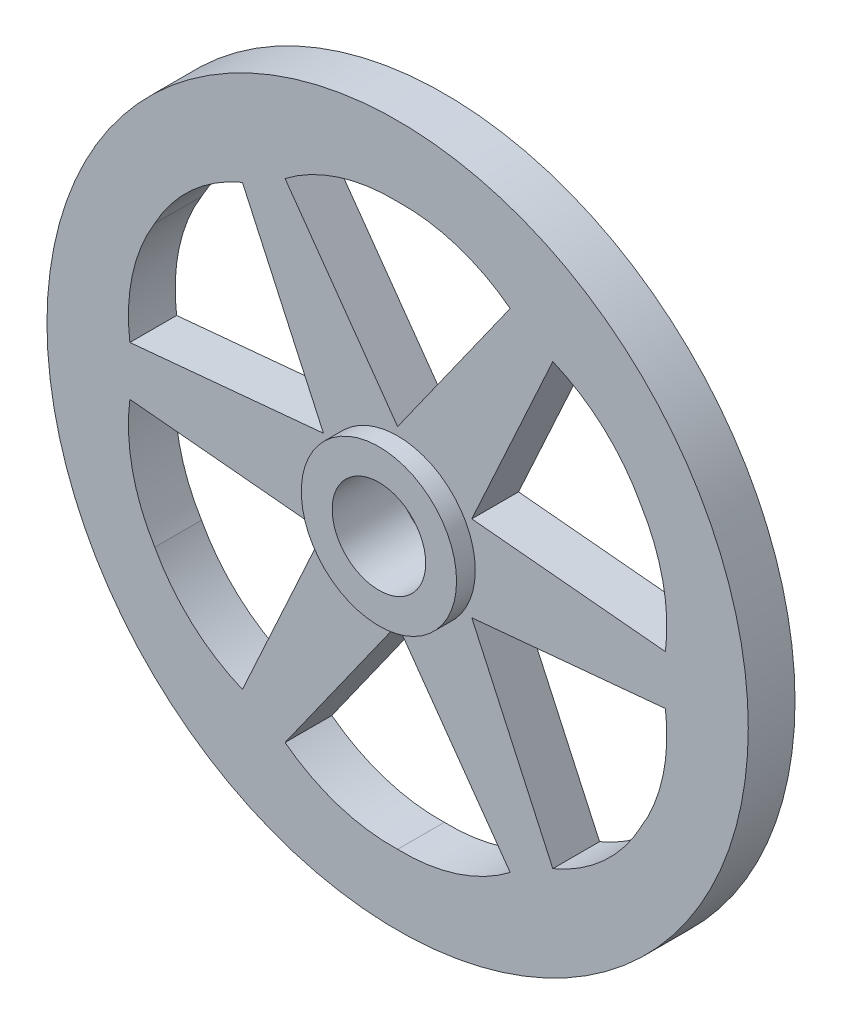
from build123d import *

# Parameters (mm, degrees)
SKETCH1_R           = 37.5
SKETCH1_R_2         = 5
BOSS_EXTRUDE1_DEPTH = 2.5
CUT_EXTRUDE1_DEPTH  = 4
CIRPATTERN1_COUNT   = 6
SKETCH4_R           = 8.302662018
SKETCH4_R_2         = 5
BOSS_EXTRUDE2_DEPTH = 2


with BuildPart() as part:
    # Sketch1 → Boss-Extrude1 (new, symmetric)
    with BuildSketch(Plane.XY):
        Circle(SKETCH1_R)
        Circle(SKETCH1_R_2, mode=Mode.SUBTRACT)
    extrude(amount=BOSS_EXTRUDE1_DEPTH, both=True)

    # Sketch2 → Cut-Extrude1 (cut, symmetric)
    with BuildSketch(Plane.XY):
        with BuildLine():
            Line((0, 9.158641407), (-12.037071564, 26.115211784))
            ThreePointArc((-12.037071564, 26.115211784), (-6.351662121, 29.087034336), (0, 29.988143709))
            ThreePointArc((0, 29.988143709), (6.351662121, 29.087034336), (12.037071564, 26.115211784))
            Line((12.037071564, 26.115211784), (0, 9.158641407))
        make_face()
    cut_extrude1 = extrude(amount=CUT_EXTRUDE1_DEPTH, both=True, mode=Mode.SUBTRACT)

    # CirPattern1: Cut-Extrude1 ×6 about axis
    cirpattern1_axis = Axis((0, 0, 2.5), (0, 0, -1))
    for i in range(1, CIRPATTERN1_COUNT):
        add(cut_extrude1.rotate(cirpattern1_axis, i * 360 / CIRPATTERN1_COUNT), mode=Mode.SUBTRACT)

    # Sketch4 → Boss-Extrude2 (add)
    with BuildSketch(Plane.XY.offset(2.5)):
        Circle(SKETCH4_R)
        Circle(SKETCH4_R_2, mode=Mode.SUBTRACT)
    extrude(amount=BOSS_EXTRUDE2_DEPTH)


solid = part.part
